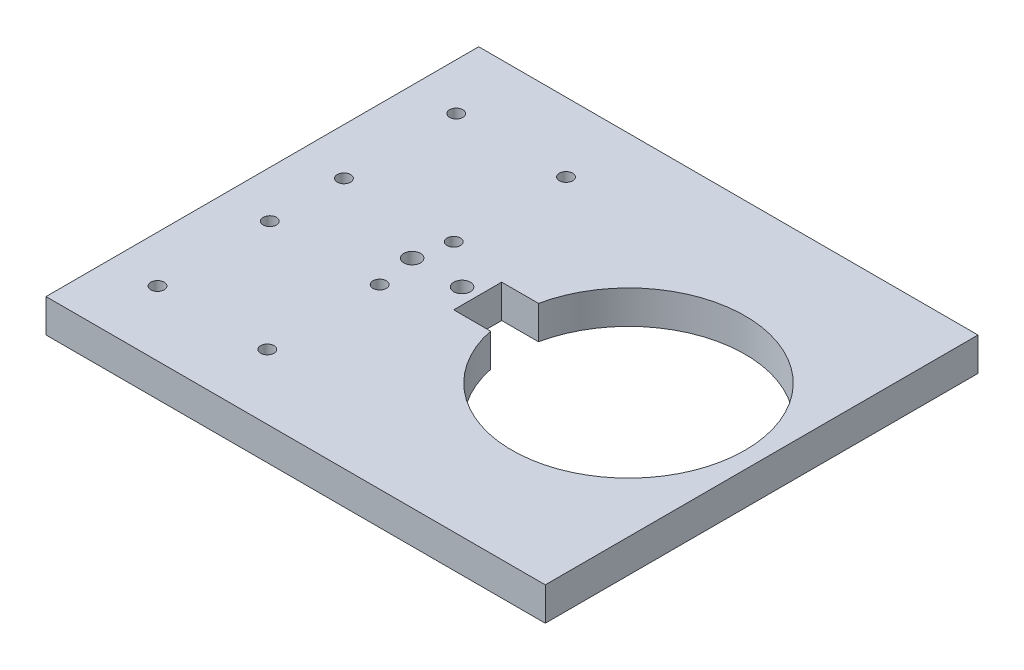
from build123d import *

# Parameters (mm, degrees)
SKETCH1_W           = 150
SKETCH1_H           = 130
SKETCH1_R           = 2.5
SKETCH1_R_2         = 2
BOSS_EXTRUDE1_DEPTH = 10


with BuildPart() as part:
    # Sketch1 → Boss-Extrude1 (new body)
    with BuildSketch(Plane(origin=(0, 0, 0), x_dir=(1, 0, 0), z_dir=(0, 1, 0))):
        Rectangle(SKETCH1_W, SKETCH1_H)
        with Locations((-15, 0)):
            Circle(SKETCH1_R, mode=Mode.SUBTRACT)
        with Locations((-30, 0)):
            Circle(SKETCH1_R, mode=Mode.SUBTRACT)
        with Locations((-61, -11.762234795)):
            Circle(SKETCH1_R_2, mode=Mode.SUBTRACT)
        with Locations((-61, -45.5)):
            Circle(SKETCH1_R_2, mode=Mode.SUBTRACT)
        with Locations((-28, -45.5)):
            Circle(SKETCH1_R_2, mode=Mode.SUBTRACT)
        with Locations((-28, -11.762234795)):
            Circle(SKETCH1_R_2, mode=Mode.SUBTRACT)
        with Locations((-28, 10.5)):
            Circle(SKETCH1_R_2, mode=Mode.SUBTRACT)
        with Locations((-61, 10.5)):
            Circle(SKETCH1_R_2, mode=Mode.SUBTRACT)
        with Locations((-61, 44.237765205)):
            Circle(SKETCH1_R_2, mode=Mode.SUBTRACT)
        with Locations((-28, 44.237765205)):
            Circle(SKETCH1_R_2, mode=Mode.SUBTRACT)
        with BuildLine():
            Line((0.750570036, -7.209476205), (-10.305683507, -7.209476205))
            Line((-10.305683507, -7.209476205), (-10.305683507, 7.209476205))
            Line((-10.305683507, 7.209476205), (0.750570036, 7.209476205))
            ThreePointArc((0.750570036, 7.209476205), (70, 0), (0.750570036, -7.209476205))
        make_face(mode=Mode.SUBTRACT)
    extrude(amount=BOSS_EXTRUDE1_DEPTH)


solid = part.part
